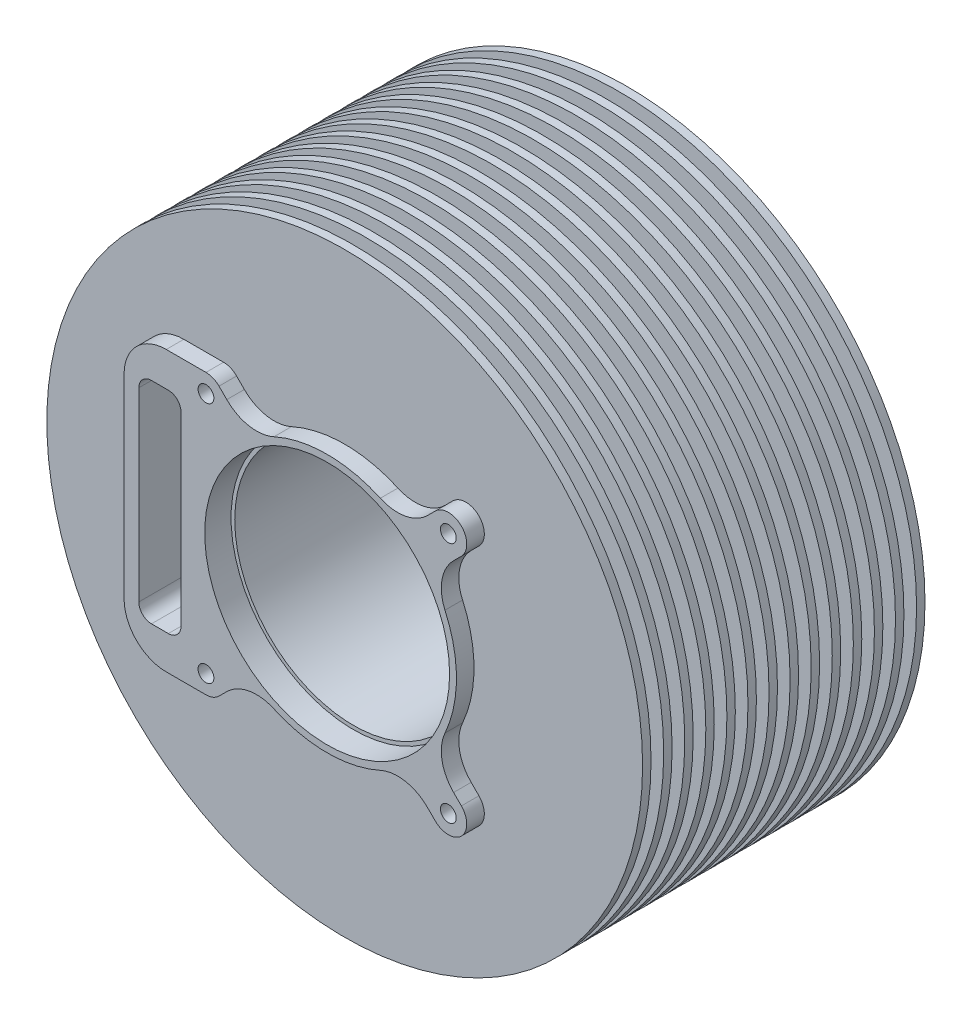
from build123d import *

# Parameters (mm, degrees)
SKETCH1_R           = 3.75
SKETCH1_R_2         = 56.35
BOSS_EXTRUDE1_DEPTH = 142.33
SKETCH2_R           = 58.1
CUT_EXTRUDE1_DEPTH  = 12.5
BOSS_EXTRUDE2_DEPTH = 142.33
SKETCH5_R           = 141.35
BOSS_EXTRUDE3_DEPTH = 4
LPATTERN1_COUNT     = 14
LPATTERN1_PITCH     = 10


with BuildPart() as part:
    # Sketch1 → Boss-Extrude1 (new body)
    with BuildSketch(Plane.XY):
        with BuildLine():
            Line((-91.753874008, 59.998242678), (-95.442815665, 63.687184335))
            ThreePointArc((-95.442815665, 63.687184335), (-107.817184335, 63.687184335), (-107.817184335, 51.312815665))
            Line((-107.817184335, 51.312815665), (-104.128242678, 47.623874008))
            ThreePointArc((-104.128242678, 47.623874008), (-98.595683476, 37.074283929), (-100.042872881, 25.250210816))
            ThreePointArc((-100.042872881, 25.250210816), (-105.48, 0), (-100.042872881, -25.250210816))
            ThreePointArc((-100.042872881, -25.250210816), (-98.595683476, -37.074283929), (-104.128242678, -47.623874008))
            Line((-104.128242678, -47.623874008), (-107.817184335, -51.312815665))
            ThreePointArc((-107.817184335, -51.312815665), (-107.817184335, -63.687184335), (-95.442815665, -63.687184335))
            Line((-95.442815665, -63.687184335), (-91.753874008, -59.998242678))
            ThreePointArc((-91.753874008, -59.998242678), (-81.204283929, -54.465683476), (-69.380210816, -55.912872881))
            ThreePointArc((-69.380210816, -55.912872881), (-44.13, -61.35), (-18.879789184, -55.912872881))
            ThreePointArc((-18.879789184, -55.912872881), (-7.055716071, -54.465683476), (3.493874008, -59.998242678))
            Line((3.493874008, -59.998242678), (7.182815665, -63.687184335))
            ThreePointArc((7.182815665, -63.687184335), (19.557184335, -63.687184335), (19.557184335, -51.312815665))
            Line((19.557184335, -51.312815665), (15.868242678, -47.623874008))
            ThreePointArc((15.868242678, -47.623874008), (10.335683476, -37.074283929), (11.782872881, -25.250210816))
            ThreePointArc((11.782872881, -25.250210816), (17.22, 0), (11.782872881, 25.250210816))
            ThreePointArc((11.782872881, 25.250210816), (10.335683476, 37.074283929), (15.868242678, 47.623874008))
            Line((15.868242678, 47.623874008), (19.557184335, 51.312815665))
            ThreePointArc((19.557184335, 51.312815665), (19.557184335, 63.687184335), (7.182815665, 63.687184335))
            Line((7.182815665, 63.687184335), (3.493874008, 59.998242678))
            ThreePointArc((3.493874008, 59.998242678), (-7.055716071, 54.465683476), (-18.879789184, 55.912872881))
            ThreePointArc((-18.879789184, 55.912872881), (-44.13, 61.35), (-69.380210816, 55.912872881))
            ThreePointArc((-69.380210816, 55.912872881), (-81.204283929, 54.465683476), (-91.753874008, 59.998242678))
        make_face()
        with Locations((-101.63, -57.5)):
            Circle(SKETCH1_R, mode=Mode.SUBTRACT)
        with Locations((13.37, -57.5)):
            Circle(SKETCH1_R, mode=Mode.SUBTRACT)
        with Locations((13.37, 57.5)):
            Circle(SKETCH1_R, mode=Mode.SUBTRACT)
        with Locations((-44.13, 0)):
            Circle(SKETCH1_R_2, mode=Mode.SUBTRACT)
        with Locations((-101.63, 57.5)):
            Circle(SKETCH1_R, mode=Mode.SUBTRACT)
    extrude(amount=BOSS_EXTRUDE1_DEPTH)

    # Sketch2 → Cut-Extrude1 (cut)
    with BuildSketch(Plane.XY.offset(142.33)):
        with Locations((-44.13, 0)):
            Circle(SKETCH2_R)
    extrude(amount=-CUT_EXTRUDE1_DEPTH, mode=Mode.SUBTRACT)

    # Sketch4 → Boss-Extrude2 (add)
    with BuildSketch(Plane.XY):
        with BuildLine():
            Line((-104.128242678, -47.623874008), (-107.817184335, -51.312815665))
            ThreePointArc((-107.817184335, -51.312815665), (-109.713945909, -60.848480033), (-101.63, -66.25))
            Line((-101.63, -66.25), (-120.48, -66.25))
            ThreePointArc((-120.48, -66.25), (-134.622135624, -60.392135624), (-140.48, -46.25))
            Line((-140.48, -46.25), (-140.48, 46.25))
            ThreePointArc((-140.48, 46.25), (-134.622135624, 60.392135624), (-120.48, 66.25))
            Line((-120.48, 66.25), (-101.63, 66.25))
            ThreePointArc((-101.63, 66.25), (-109.713945909, 60.848480033), (-107.817184335, 51.312815665))
            Line((-107.817184335, 51.312815665), (-104.128242678, 47.623874008))
            ThreePointArc((-104.128242678, 47.623874008), (-98.595683476, 37.074283929), (-100.042872881, 25.250210816))
            ThreePointArc((-100.042872881, 25.250210816), (-105.48, 0), (-100.042872881, -25.250210816))
            ThreePointArc((-100.042872881, -25.250210816), (-98.595683476, -37.074283929), (-104.128242678, -47.623874008))
        make_face()
        with BuildLine():
            Line((-127.48, 50), (-119.48, 50))
            ThreePointArc((-119.48, 50), (-115.237359313, 48.242640687), (-113.48, 44))
            Line((-113.48, 44), (-113.48, -44))
            ThreePointArc((-113.48, -44), (-115.237359313, -48.242640687), (-119.48, -50))
            Line((-119.48, -50), (-127.48, -50))
            ThreePointArc((-127.48, -50), (-131.722640687, -48.242640687), (-133.48, -44))
            Line((-133.48, -44), (-133.48, 44))
            ThreePointArc((-133.48, 44), (-131.722640687, 48.242640687), (-127.48, 50))
        make_face(mode=Mode.SUBTRACT)
    extrude(amount=BOSS_EXTRUDE2_DEPTH)

    # Sketch5 → Boss-Extrude3 (add)
    with BuildSketch(Plane.XY):
        with Locations((-44.13, 0)):
            Circle(SKETCH5_R)
        with BuildLine():
            Line((-120.48, 66.25), (-101.63, 66.25))
            ThreePointArc((-101.63, 66.25), (-98.281519967, 65.583945909), (-95.442815665, 63.687184335))
            Line((-95.442815665, 63.687184335), (-91.753874008, 59.998242678))
            ThreePointArc((-91.753874008, 59.998242678), (-81.204283929, 54.465683476), (-69.380210816, 55.912872881))
            ThreePointArc((-69.380210816, 55.912872881), (-44.13, 61.35), (-18.879789184, 55.912872881))
            ThreePointArc((-18.879789184, 55.912872881), (-7.055716071, 54.465683476), (3.493874008, 59.998242678))
            Line((3.493874008, 59.998242678), (7.182815665, 63.687184335))
            ThreePointArc((7.182815665, 63.687184335), (19.557184335, 63.687184335), (19.557184335, 51.312815665))
            Line((19.557184335, 51.312815665), (15.868242678, 47.623874008))
            ThreePointArc((15.868242678, 47.623874008), (10.335683476, 37.074283929), (11.782872881, 25.250210816))
            ThreePointArc((11.782872881, 25.250210816), (17.22, 0), (11.782872881, -25.250210816))
            ThreePointArc((11.782872881, -25.250210816), (10.335683476, -37.074283929), (15.868242678, -47.623874008))
            Line((15.868242678, -47.623874008), (19.557184335, -51.312815665))
            ThreePointArc((19.557184335, -51.312815665), (19.557184335, -63.687184335), (7.182815665, -63.687184335))
            Line((7.182815665, -63.687184335), (3.493874008, -59.998242678))
            ThreePointArc((3.493874008, -59.998242678), (-7.055716071, -54.465683476), (-18.879789184, -55.912872881))
            ThreePointArc((-18.879789184, -55.912872881), (-44.13, -61.35), (-69.380210816, -55.912872881))
            ThreePointArc((-69.380210816, -55.912872881), (-81.204283929, -54.465683476), (-91.753874008, -59.998242678))
            Line((-91.753874008, -59.998242678), (-95.442815665, -63.687184335))
            ThreePointArc((-95.442815665, -63.687184335), (-98.281519967, -65.583945909), (-101.63, -66.25))
            Line((-101.63, -66.25), (-120.48, -66.25))
            ThreePointArc((-120.48, -66.25), (-134.622135624, -60.392135624), (-140.48, -46.25))
            Line((-140.48, -46.25), (-140.48, 46.25))
            ThreePointArc((-140.48, 46.25), (-134.622135624, 60.392135624), (-120.48, 66.25))
        make_face(mode=Mode.SUBTRACT)
    boss_extrude3 = extrude(amount=BOSS_EXTRUDE3_DEPTH)

    # LPattern1: Boss-Extrude3 ×14
    with Locations(*[(0, 0, i * LPATTERN1_PITCH) for i in range(1, LPATTERN1_COUNT)]):
        add(boss_extrude3)


solid = part.part
